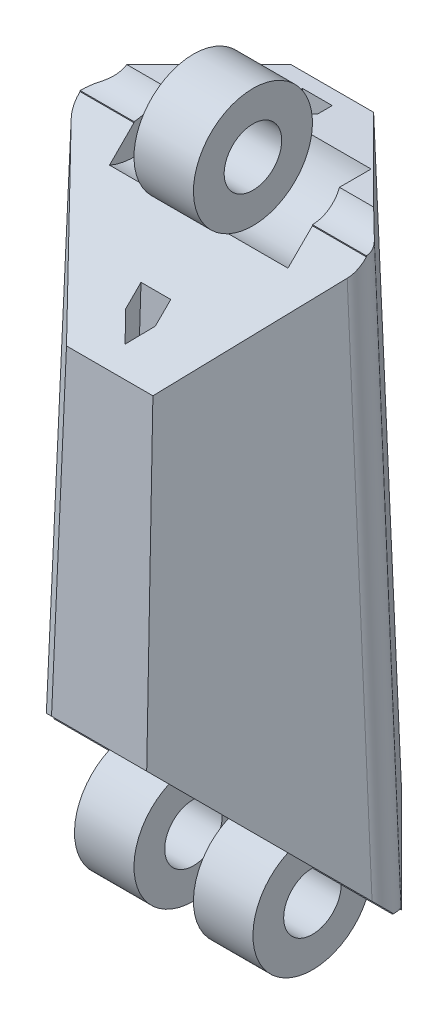
from build123d import *

# Parameters (mm, degrees)
LOFT1_DEPTH             = 30
LOFT1_DRAFT             = 1.9091524
CUT_EXTRUDE2_DEPTH      = 32.988279093
CUT_EXTRUDE2_DEPTH_BACK = 32.988279093
FILLET2_R               = 1
SKETCH4_R               = 3
BOSS_EXTRUDE1_DEPTH     = 1.5
CUT_EXTRUDE3_START      = 3
SKETCH5_R               = 3
CUT_EXTRUDE3_DEPTH      = 3
SKETCH6_R               = 3
CUT_EXTRUDE4_DEPTH      = 1.5
BOSS_EXTRUDE2_START     = -3
SKETCH7_R               = 3
BOSS_EXTRUDE2_DEPTH     = 3
CUT_EXTRUDE5_DEPTH      = 22.529931357
CUT_EXTRUDE5_DEPTH_BACK = 22.529931357
CUT_EXTRUDE6_DEPTH      = 22.746838212
CUT_EXTRUDE6_DEPTH_BACK = 22.746838212
CUT_EXTRUDE7_DEPTH      = 36.188368954
CUT_EXTRUDE7_DEPTH_BACK = 36.188368954
SKETCH10_R              = 1.45


# Read off the part's stored shape, not the designer's step: Loft1
with BuildPart() as part:
    # Loft1 outline → Loft1 (with draft: the straight prism first)
    with BuildSketch(Plane(origin=(0, 30, 0), x_dir=(1, 0, 0), z_dir=(0, 1, 0))):
        Polygon((2.085786438, 5.5), (-2.085786438, 5.5), (-7.585786438, 0), (-2.085786438, -5.5), (2.085786438, -5.5), (7.585786438, 0), align=None)
    extrude(amount=-LOFT1_DEPTH)
    # Loft1: the draft: its side faces are tilted about the plane it starts from
    loft1_sides = [part.faces().sort_by_distance(p)[0] for p in [
        (0, 15, -5.5),
        (-4.835786438, 15, -2.75),
        (-4.835786438, 15, 2.75),
        (0, 15, 5.5),
        (4.835786438, 15, 2.75),
        (4.835786438, 15, -2.75),
    ]]
    draft(loft1_sides, Plane(origin=(0, 30, 0), x_dir=(1, 0, 0), z_dir=(0, 1, 0)), LOFT1_DRAFT)

    # Sketch3 → Cut-Extrude2 (cut, two sides: drawn at the far end of the back side and taken through both)
    with BuildSketch(Plane(origin=(0, 0, 0), x_dir=(0, 0, -1), z_dir=(1, 0, 0)).offset(-CUT_EXTRUDE2_DEPTH_BACK)):
        Polygon((0, 30), (0, 29), (-5.724137931, 23.275862069), (-5.5, 30), align=None)
        Polygon((0, 0), (0, 1), (-6.258064516, 7.258064516), (-6.5, 0), align=None)
    extrude(amount=CUT_EXTRUDE2_DEPTH + CUT_EXTRUDE2_DEPTH_BACK, mode=Mode.SUBTRACT)

    # Fillet2
    # the kernel refuses this fillet: 1 mm, written as the material it takes off along each edge
    with BuildSketch(Plane(origin=(-7.515337072, 31.494456763, 0), x_dir=(0.70593033942015, -0.0332778747610444, -0.7074990734534851), z_dir=(-0.04708816012216718, -0.9988907373563483, 0))) as fillet2_piece_1:
        with BuildLine():
            CenterArc((FILLET2_R * 0.998890737356, FILLET2_R), FILLET2_R, 180.063591331, 89.936408669)
            Line((-FILLET2_R * 0.00110864672901, FILLET2_R * 0.998890122125), (0, 0))
            Line((0, 0), (FILLET2_R * 0.998890737356, 0))
        make_face()
    extrude(amount=33.025547532, mode=Mode.SUBTRACT)
    with BuildSketch(Plane(origin=(7.515337072, 31.494456763, 0), x_dir=(-0.7059303394201507, -0.03327787476104443, -0.7074990734534845), z_dir=(0.04708816012216718, -0.9988907373563483, 0))) as fillet2_piece_2:
        with BuildLine():
            CenterArc((FILLET2_R * 0.998890737356, -FILLET2_R), FILLET2_R, 90, 89.936408669)
            Line((-FILLET2_R * 0.00110864672901, -FILLET2_R * 0.998890122125), (0, 0))
            Line((0, 0), (FILLET2_R * 0.998890737356, 0))
        make_face()
    extrude(amount=33.025547532, mode=Mode.SUBTRACT)

    # Sketch4 → Boss-Extrude1 (add, symmetric)
    with BuildSketch(Plane(origin=(0, 0, 0), x_dir=(0, 0, -1), z_dir=(1, 0, 0))):
        with Locations((0, 30.5)):
            Circle(SKETCH4_R)
    extrude(amount=BOSS_EXTRUDE1_DEPTH, both=True)

    # Sketch5 → Cut-Extrude3 (cut)
    with BuildSketch(Plane(origin=(1.5, 0, 0), x_dir=(0, 0, -1), z_dir=(1, 0, 0)).offset(CUT_EXTRUDE3_START)):
        with Locations((0, 30.5)):
            Circle(SKETCH5_R)
    cut_extrude3 = extrude(amount=-CUT_EXTRUDE3_DEPTH, mode=Mode.SUBTRACT)

    # Mirror1: Cut-Extrude3 across plane
    add(cut_extrude3.mirror(Plane(origin=(0, 0, 0), x_dir=(0, 0, 1), z_dir=(1, 0, 0))), mode=Mode.SUBTRACT)

    # Sketch6 → Cut-Extrude4 (cut, symmetric)
    with BuildSketch(Plane(origin=(0, 0, 0), x_dir=(0, 0, -1), z_dir=(1, 0, 0))):
        with Locations((0, -0.5)):
            Circle(SKETCH6_R)
    extrude(amount=CUT_EXTRUDE4_DEPTH, both=True, mode=Mode.SUBTRACT)

    # Sketch7 → Boss-Extrude2 (add)
    with BuildSketch(Plane.ZY.offset(-1.5).offset(BOSS_EXTRUDE2_START)):
        with Locations((0, -0.5)):
            Circle(SKETCH7_R)
    boss_extrude2 = extrude(amount=BOSS_EXTRUDE2_DEPTH)

    # Mirror2: Boss-Extrude2 across plane
    add(boss_extrude2.mirror(Plane(origin=(0, 0, 0), x_dir=(0, 0, 1), z_dir=(1, 0, 0))))

    # Sketch8 → Cut-Extrude5 (cut, two sides: drawn at the far end of the back side and taken through both)
    with BuildSketch(Plane(origin=(0, 15.050537099, -0.50168457), x_dir=(1, 0, 0), z_dir=(0, 0.9994449069791544, -0.0333148302326385)).offset(-CUT_EXTRUDE5_DEPTH_BACK)):
        Polygon((-0.75, -4.246391895), (0.75, -4.246391895), (0.75, -4.996391895), (0, -5.746391895), (-0.75, -4.996391895), align=None)
    extrude(amount=CUT_EXTRUDE5_DEPTH + CUT_EXTRUDE5_DEPTH_BACK, mode=Mode.SUBTRACT)

    # Sketch9 → Cut-Extrude6 (cut, two sides: drawn at the far end of the back side and taken through both)
    with BuildSketch(Plane(origin=(0, 14.783573807, 0.492785794), x_dir=(1, 0, 0), z_dir=(0, 0.9994449069791544, 0.0333148302326385)).offset(-CUT_EXTRUDE6_DEPTH_BACK)):
        Polygon((-0.75, 5.746391895), (0.75, 5.746391895), (0.75, 4.996391895), (0, 4.246391895), (-0.75, 4.996391895), align=None)
    extrude(amount=CUT_EXTRUDE6_DEPTH + CUT_EXTRUDE6_DEPTH_BACK, mode=Mode.SUBTRACT)

    # Sketch10 → Cut-Extrude7 (cut, two sides: drawn at the far end of the back side and taken through both)
    with BuildSketch(Plane(origin=(0, 0, 0), x_dir=(0, 0, -1), z_dir=(1, 0, 0)).offset(-CUT_EXTRUDE7_DEPTH_BACK)):
        with Locations((0, 30.5)):
            Circle(SKETCH10_R)
        with Locations((0, -0.5)):
            Circle(SKETCH10_R)
    extrude(amount=CUT_EXTRUDE7_DEPTH + CUT_EXTRUDE7_DEPTH_BACK, mode=Mode.SUBTRACT)


solid = part.part
